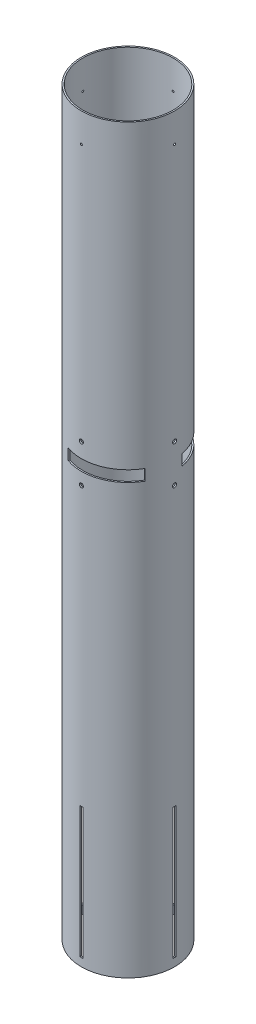
from build123d import *

# Parameters (mm, degrees)
SKETCH1_R              = 51.1048
SKETCH1_R_2            = 49.53
BOSS_EXTRUDE1_DEPTH    = 812.8
CUT_EXTRUDE1_DEPTH     = 817.00688794
CIRPATTERN1_COUNT      = 4
CUT_EXTRUDE2_DEPTH     = 817.00688794
CIRPATTERN2_COUNT      = 4
SKETCH3_R              = 3.175
CUT_EXTRUDE3_DEPTH     = 817.006888054
CUT_EXTRUDE4_START     = 470.535
CUT_EXTRUDE4_DEPTH     = 12.065
CIRPATTERN3_COUNT      = 3
LPATTERN1_COPY_1_DEPTH = 817.00688794
LPATTERN1_COPY_2_DEPTH = 817.00688794
LPATTERN1_COPY_3_DEPTH = 817.00688794
LPATTERN1_COPY_4_DEPTH = 817.00688794
SKETCH8_R              = 1.0922
CUT_EXTRUDE5_DEPTH     = 817.006888054
CIRPATTERN4_COUNT      = 4
SKETCH18_W             = 6.54812
SKETCH18_H             = 51.1048


with BuildPart() as part:
    # Sketch1 → Boss-Extrude1 (new body)
    with BuildSketch(Plane(origin=(0, 0, 0), x_dir=(1, 0, 0), z_dir=(0, 1, 0))):
        Circle(SKETCH1_R)
        Circle(SKETCH1_R_2, mode=Mode.SUBTRACT)
    extrude(amount=BOSS_EXTRUDE1_DEPTH)

    # Sketch2 → Cut-Extrude1 (cut, through all)
    with BuildSketch(Plane(origin=(0, 0, 0), x_dir=(0, 0, -1), z_dir=(1, 0, 0))):
        Polygon((0, 8.89), (1.5875, 8.89), (1.5875, 152.4), (-1.5875, 152.4), (-1.5875, 8.89), align=None)
    cut_extrude1 = extrude(amount=-CUT_EXTRUDE1_DEPTH, mode=Mode.SUBTRACT)

    # CirPattern1: Cut-Extrude1 ×4 about axis
    cirpattern1_axis = Axis((0, 0, 0), (0, 1, 0))
    for i in range(1, CIRPATTERN1_COUNT):
        add(cut_extrude1.rotate(cirpattern1_axis, i * 360 / CIRPATTERN1_COUNT), mode=Mode.SUBTRACT)

    # Sketch2<3> → Cut-Extrude2 (cut, through all)
    with BuildSketch(Plane(origin=(0, 0, 0), x_dir=(0, 0, -1), z_dir=(1, 0, 0))):
        with BuildLine():
            ThreePointArc((0, 501.200005345), (-1.590990219, 497.359015181), (2.249999945, 498.9500054))
            ThreePointArc((2.249999945, 498.9500054), (1.590990219, 500.540995619), (0, 501.200005345))
        make_face()
    cut_extrude2 = extrude(amount=-CUT_EXTRUDE2_DEPTH, mode=Mode.SUBTRACT)

    # CirPattern2: Cut-Extrude2 ×4 about axis
    cirpattern2_axis = Axis((0, 812.8, 0), (0, -1, 0))
    for i in range(1, CIRPATTERN2_COUNT):
        add(cut_extrude2.rotate(cirpattern2_axis, i * 360 / CIRPATTERN2_COUNT), mode=Mode.SUBTRACT)

    # Sketch3 → Cut-Extrude3 (cut, through all)
    with BuildSketch(Plane(origin=(0, 0, 0), x_dir=(0.7071067811865477, 0, -0.7071067811865475), z_dir=(0.7071067811865475, 0, 0.7071067811865477))):
        with Locations((0, 127)):
            Circle(SKETCH3_R)
    extrude(amount=-CUT_EXTRUDE3_DEPTH, mode=Mode.SUBTRACT)

    # Sketch7 → Cut-Extrude4 (cut)
    with BuildSketch(Plane(origin=(0, 0, 0), x_dir=(1, 0, 0), z_dir=(0, 1, 0)).offset(CUT_EXTRUDE4_START)):
        with BuildLine():
            Line((-44.258055055, -25.5524), (-42.894238249, -24.765))
            ThreePointArc((-42.894238249, -24.765), (-48.777528007, 8.60079424), (-31.837270308, 37.942181268))
            Line((-31.837270308, 37.942181268), (-32.849532236, 39.148548057))
            ThreePointArc((-32.849532236, 39.148548057), (-45.829888074, 22.612428931), (-51.055245404, 2.249999945))
            ThreePointArc((-51.055245404, 2.249999945), (-51.1048, 0), (-51.055245404, -2.249999945))
            ThreePointArc((-51.055245404, -2.249999945), (-49.060236172, -14.310618779), (-44.258055055, -25.5524))
        make_face()
    cut_extrude4 = extrude(amount=CUT_EXTRUDE4_DEPTH, mode=Mode.SUBTRACT)

    # CirPattern3: Cut-Extrude4 ×3 about axis
    cirpattern3_axis = Axis((0, 812.8, 0), (0, -1, 0))
    for i in range(1, CIRPATTERN3_COUNT):
        add(cut_extrude4.rotate(cirpattern3_axis, i * 360 / CIRPATTERN3_COUNT), mode=Mode.SUBTRACT)

    # LPattern1 copy 1 sketch → LPattern1 copy 1 (cut, through all)
    with BuildSketch(Plane(origin=(0, -41.6916108, 0), x_dir=(1, 0, 0), z_dir=(0, 0, 1))):
        with BuildLine():
            ThreePointArc((0, 501.200005345), (-1.590990219, 497.359015181), (2.249999945, 498.9500054))
            ThreePointArc((2.249999945, 498.9500054), (1.590990219, 500.540995619), (0, 501.200005345))
        make_face()
    extrude(amount=-LPATTERN1_COPY_1_DEPTH, mode=Mode.SUBTRACT)

    # LPattern1 copy 2 sketch → LPattern1 copy 2 (cut, through all)
    with BuildSketch(Plane(origin=(0, -41.6916108, 0), x_dir=(0, 0, 1), z_dir=(-1, 0, 0))):
        with BuildLine():
            ThreePointArc((0, 501.200005345), (-1.590990219, 497.359015181), (2.249999945, 498.9500054))
            ThreePointArc((2.249999945, 498.9500054), (1.590990219, 500.540995619), (0, 501.200005345))
        make_face()
    extrude(amount=-LPATTERN1_COPY_2_DEPTH, mode=Mode.SUBTRACT)

    # LPattern1 copy 3 sketch → LPattern1 copy 3 (cut, through all)
    with BuildSketch(Plane(origin=(0, -41.6916108, 0), x_dir=(-1, 0, 0), z_dir=(0, 0, -1))):
        with BuildLine():
            ThreePointArc((0, 501.200005345), (-1.590990219, 497.359015181), (2.249999945, 498.9500054))
            ThreePointArc((2.249999945, 498.9500054), (1.590990219, 500.540995619), (0, 501.200005345))
        make_face()
    extrude(amount=-LPATTERN1_COPY_3_DEPTH, mode=Mode.SUBTRACT)

    # LPattern1 copy 4 sketch → LPattern1 copy 4 (cut, through all)
    with BuildSketch(Plane(origin=(0, -41.6916108, 0), x_dir=(0, 0, -1), z_dir=(1, 0, 0))):
        with BuildLine():
            ThreePointArc((0, 501.200005345), (-1.590990219, 497.359015181), (2.249999945, 498.9500054))
            ThreePointArc((2.249999945, 498.9500054), (1.590990219, 500.540995619), (0, 501.200005345))
        make_face()
    extrude(amount=-LPATTERN1_COPY_4_DEPTH, mode=Mode.SUBTRACT)

    # Sketch8 → Cut-Extrude5 (cut, through all)
    with BuildSketch(Plane.XY):
        with Locations((0, 781.05)):
            Circle(SKETCH8_R)
    cut_extrude5 = extrude(amount=-CUT_EXTRUDE5_DEPTH, mode=Mode.SUBTRACT)

    # CirPattern4: Cut-Extrude5 ×4 about axis
    cirpattern4_axis = Axis((0, 812.8, 0), (0, -1, 0))
    for i in range(1, CIRPATTERN4_COUNT):
        add(cut_extrude5.rotate(cirpattern4_axis, i * 360 / CIRPATTERN4_COUNT), mode=Mode.SUBTRACT)

    # Sketch18 → 1/2 Clearance Hole4 (revolve, cut)
    with BuildSketch(Plane(origin=(0, 752.856, 0), x_dir=(0, -1, 0), z_dir=(1, 0, 0))):
        with Locations((3.27406, 25.5524)):
            Rectangle(SKETCH18_W, SKETCH18_H)
    revolve(axis=Axis((0, 752.856, 6.35), (0, 0, -1)), mode=Mode.SUBTRACT)


solid = part.part
